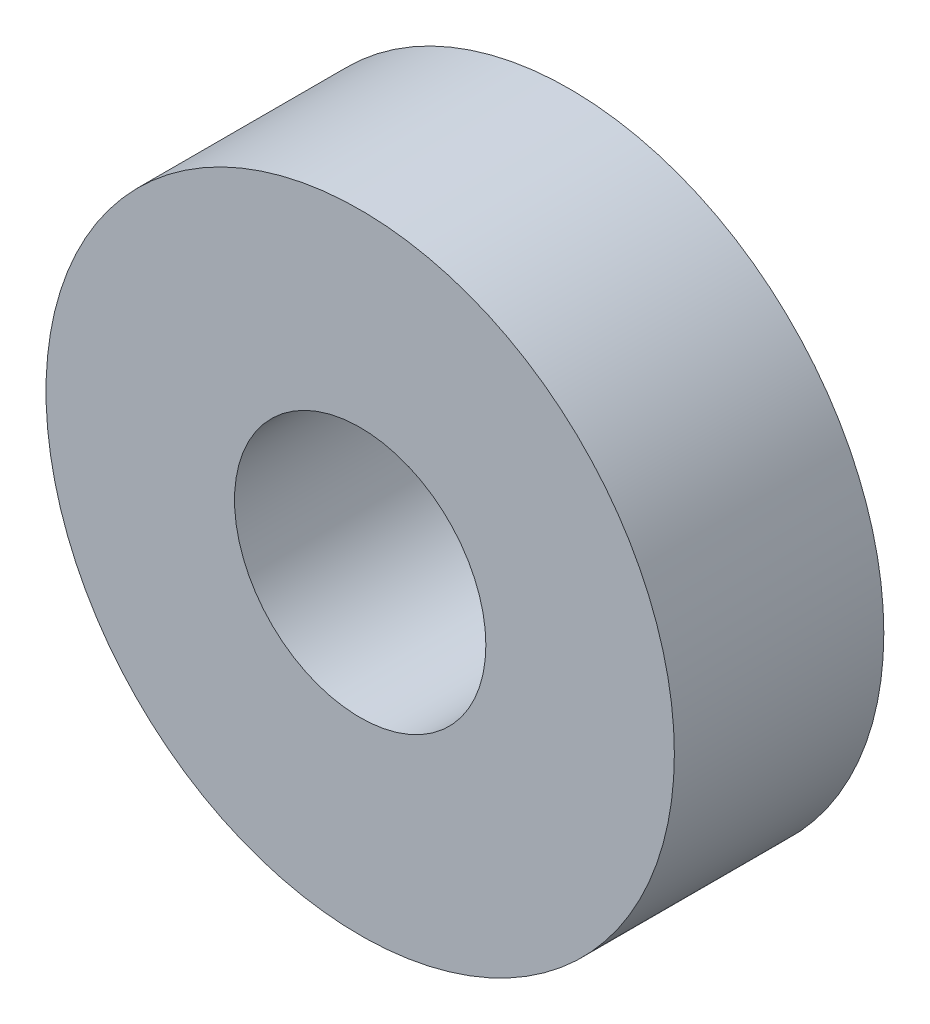
from build123d import *

# Parameters (mm, degrees)
EXTRUDE_1_DEPTH      = 2.5
EXTRUDE_1_DEPTH_BACK = 2.5
SKETCH_1_R           = 7.5
SKETCH_1_R_2         = 3


with BuildPart() as part:
    # 草图1 → 凸台-拉伸1 (new, two sides: drawn at the far end of the back side and taken through both)
    with BuildSketch(Plane.XY.offset(-EXTRUDE_1_DEPTH_BACK)):
        Circle(SKETCH_1_R)
        Circle(SKETCH_1_R_2, mode=Mode.SUBTRACT)
    extrude(amount=EXTRUDE_1_DEPTH + EXTRUDE_1_DEPTH_BACK)


solid = part.part
